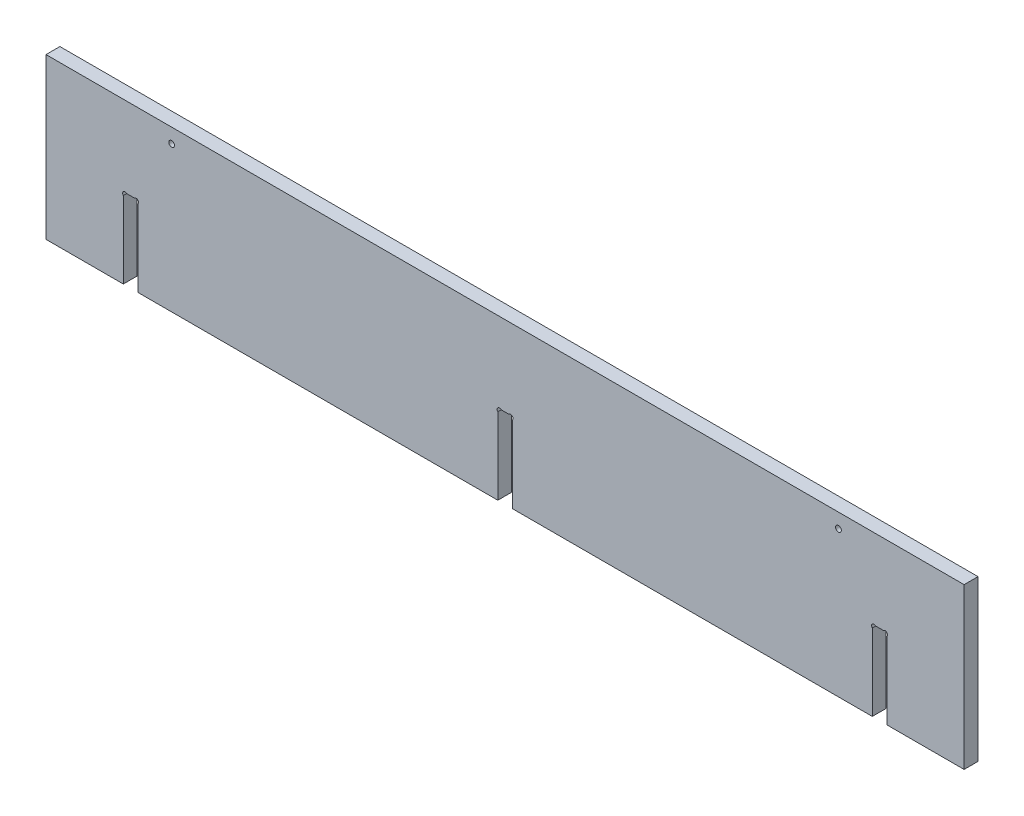
from build123d import *

# Parameters (mm, degrees)
BOSS_EXTRUDE1_DEPTH              = 18.25625
F_19_64_0_29688_DIAMETER_HOLE1_D = 7.540752


with BuildPart() as part:
    # Sketch1 → Boss-Extrude1 (new body)
    with BuildSketch(Plane.XY):
        with BuildLine():
            Line((-483.681661624, 294.476236842), (405.318338376, 294.476236842))
            Line((405.318338376, 294.476236842), (626.774588376, 294.476236842))
            Line((626.774588376, 294.476236842), (626.774588376, 84.132486842))
            Line((626.774588376, 84.132486842), (525.174588376, 84.132486842))
            Line((525.174588376, 84.132486842), (525.174588376, 184.798358782))
            ThreePointArc((525.174588376, 184.798358782), (525.174588376, 189.288486842), (520.684460316, 189.288486842))
            Line((520.684460316, 189.288486842), (510.614716437, 189.288486842))
            ThreePointArc((510.614716437, 189.288486842), (506.124588376, 189.288486842), (506.124588376, 184.798358782))
            Line((506.124588376, 184.798358782), (506.124588376, 84.132486842))
            Line((506.124588376, 84.132486842), (33.049588376, 84.132486842))
            Line((33.049588376, 84.132486842), (33.049588376, 184.798358782))
            ThreePointArc((33.049588376, 184.798358782), (33.049588376, 189.288486842), (28.559460316, 189.288486842))
            Line((28.559460316, 189.288486842), (18.489716437, 189.288486842))
            ThreePointArc((18.489716437, 189.288486842), (13.999588376, 189.288486842), (13.999588376, 184.798358782))
            Line((13.999588376, 184.798358782), (13.999588376, 84.132486842))
            Line((13.999588376, 84.132486842), (-459.075411624, 84.132486842))
            Line((-459.075411624, 84.132486842), (-459.075411624, 184.798358782))
            ThreePointArc((-459.075411624, 184.798358782), (-459.075411624, 189.288486842), (-463.565539684, 189.288486842))
            Line((-463.565539684, 189.288486842), (-473.635283563, 189.288486842))
            ThreePointArc((-473.635283563, 189.288486842), (-478.125411624, 189.288486842), (-478.125411624, 184.798358782))
            Line((-478.125411624, 184.798358782), (-478.125411624, 84.132486842))
            Line((-478.125411624, 84.132486842), (-579.725411624, 84.132486842))
            Line((-579.725411624, 84.132486842), (-579.725411624, 294.476236842))
            Line((-579.725411624, 294.476236842), (-483.681661624, 294.476236842))
        make_face()
    extrude(amount=BOSS_EXTRUDE1_DEPTH)

    # 19/64 (0.29688) Diameter Hole1 (through all)
    with Locations(Plane(origin=(0, 0, 0), x_dir=(-1, 0, 0), z_dir=(0, 0, -1))):
        with Locations((-461.674588376, 275.426236842), (414.625411624, 275.426236842)):
            Hole(F_19_64_0_29688_DIAMETER_HOLE1_D / 2)


solid = part.part
